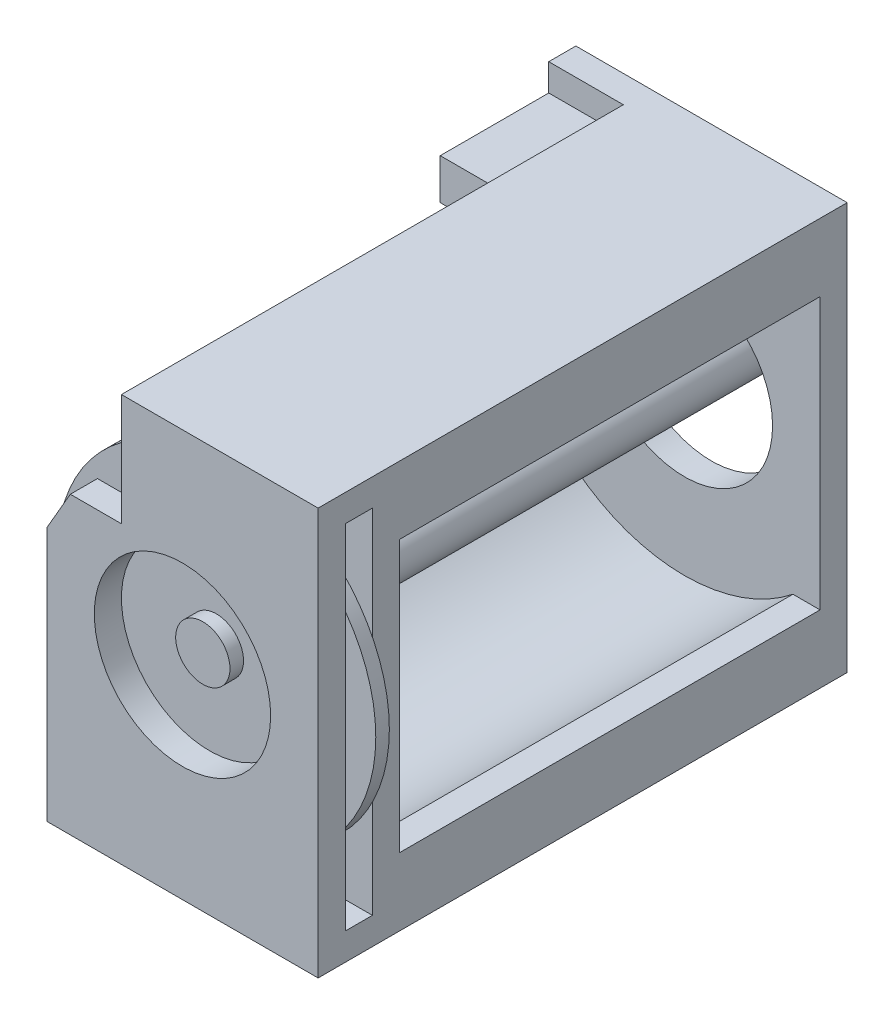
from build123d import *

# Parameters (mm, degrees)
SKETCH1_W                = 20
SKETCH1_H                = 30
SKETCH1_R                = 6.5
BOSS_EXTRUDE1_DEPTH      = 2
BOSS_EXTRUDE4_DEPTH      = 34
BOSS_EXTRUDE5_START      = 37
SKETCH1_9_W              = 20
SKETCH1_9_H              = 30
SKETCH1_9_R              = 6.5
BOSS_EXTRUDE5_DEPTH      = 2
BOSS_EXTRUDE6_START      = 33
SKETCH1_10_W             = 20
SKETCH1_10_H             = 30
SKETCH1_10_R             = 6.5
BOSS_EXTRUDE6_DEPTH      = 2
SKETCH1_11_W             = 20
SKETCH1_11_H             = 2
BOSS_EXTRUDE7_DEPTH      = 39
SKETCH2_W                = 5.5
SKETCH2_H                = 8.25
CUT_EXTRUDE1_DEPTH       = 37
BOSS_EXTRUDE10_DEPTH     = 10
BOSS_EXTRUDE8_START      = 35.5
SKETCH4_R                = 11.75
SKETCH4_R_2              = 2
BOSS_EXTRUDE8_DEPTH      = 1
BOSS_EXTRUDE9_DEPTH      = 37.5
BOSS_EXTRUDE9_DEPTH_BACK = 5
SKETCH4_2_R              = 2
CHAMFER3_SIZE            = 3
CHAMFER3_SIZE2           = 1.732050808


with BuildPart() as part:
    # Sketch1 → Boss-Extrude1 (new body)
    with BuildSketch(Plane.XY):
        Rectangle(SKETCH1_W, SKETCH1_H)
        Circle(SKETCH1_R, mode=Mode.SUBTRACT)
    extrude(amount=BOSS_EXTRUDE1_DEPTH)

    # Sketch1<7> → Boss-Extrude4 (add)
    with BuildSketch(Plane.XY):
        with BuildLine():
            Line((10, 15), (-10, 15))
            Line((-10, 15), (-10, 10))
            Line((-10, 10), (-8, 10))
            ThreePointArc((-8, 10), (0, 12.806248475), (8, 10))
            Line((8, 10), (10, 10))
            Line((10, 10), (10, 15))
        make_face()
        with BuildLine():
            Line((10, -10), (8, -10))
            ThreePointArc((8, -10), (0, -12.806248475), (-8, -10))
            Line((-8, -10), (-10, -10))
            Line((-10, -10), (-10, -15))
            Line((-10, -15), (10, -15))
            Line((10, -15), (10, -10))
        make_face()
    extrude(amount=BOSS_EXTRUDE4_DEPTH)

    # Sketch1<10> → Boss-Extrude6 (add)
    with BuildSketch(Plane.XY.offset(BOSS_EXTRUDE6_START)):
        Rectangle(SKETCH1_10_W, SKETCH1_10_H)
        Circle(SKETCH1_10_R, mode=Mode.SUBTRACT)
    extrude(amount=BOSS_EXTRUDE6_DEPTH)



with BuildPart() as body_2:
    # Sketch1<9> → Boss-Extrude5 (new body)
    with BuildSketch(Plane.XY.offset(BOSS_EXTRUDE5_START)):
        Rectangle(SKETCH1_9_W, SKETCH1_9_H)
        Circle(SKETCH1_9_R, mode=Mode.SUBTRACT)
    extrude(amount=BOSS_EXTRUDE5_DEPTH)


with BuildPart() as part_1:
    add(part.part)

    add(body_2.part)  # Boss-Extrude7 merges body 2
    # Sketch1<11> → Boss-Extrude7 (add)
    with BuildSketch(Plane.XY):
        with Locations((0, 14)):
            Rectangle(SKETCH1_11_W, SKETCH1_11_H)
        with Locations((0, -14)):
            Rectangle(SKETCH1_11_W, SKETCH1_11_H)
    extrude(amount=BOSS_EXTRUDE7_DEPTH)

    # Sketch2 → Cut-Extrude1 (cut)
    with BuildSketch(Plane.XY.offset(39)):
        with Locations((-7.25, 10.875)):
            Rectangle(SKETCH2_W, SKETCH2_H)
    extrude(amount=-CUT_EXTRUDE1_DEPTH, mode=Mode.SUBTRACT)

    # Sketch1<12> → Boss-Extrude10 (add)
    with BuildSketch(Plane.XY):
        with BuildLine():
            Line((-10, 13), (-10, 10))
            Line((-10, 10), (-8, 10))
            ThreePointArc((-8, 10), (0, 12.806248475), (8, 10))
            Line((8, 10), (8, 13))
            Line((8, 13), (-10, 13))
        make_face()
    extrude(amount=BOSS_EXTRUDE10_DEPTH)

    # Chamfer3
    chamfer3_edges = [part_1.edges().sort_by_distance(p)[0] for p in [
        (-10, 6.75, 34),
        (-10, 6.75, 38),
    ]]
    chamfer3_side = [part_1.faces().sort_by_distance(p)[0] for p in [
        (-10, 14, 1.507963416),
    ]]
    chamfer(chamfer3_edges, length=CHAMFER3_SIZE, length2=CHAMFER3_SIZE2, reference=chamfer3_side[0])


with BuildPart() as body_2_2:
    # Sketch4 → Boss-Extrude8 (new body)
    with BuildSketch(Plane.XY.offset(BOSS_EXTRUDE8_START)):
        Circle(SKETCH4_R)
        Circle(SKETCH4_R_2, mode=Mode.SUBTRACT)
    extrude(amount=BOSS_EXTRUDE8_DEPTH)


with BuildPart() as body_3:
    # Sketch4<2> → Boss-Extrude9 (new, two sides: drawn at the far end of the back side and taken through both)
    with BuildSketch(Plane.XY.offset(-BOSS_EXTRUDE9_DEPTH_BACK)):
        Circle(SKETCH4_2_R)
    extrude(amount=BOSS_EXTRUDE9_DEPTH + BOSS_EXTRUDE9_DEPTH_BACK)


solid = Compound([part_1.part, body_2_2.part, body_3.part])
